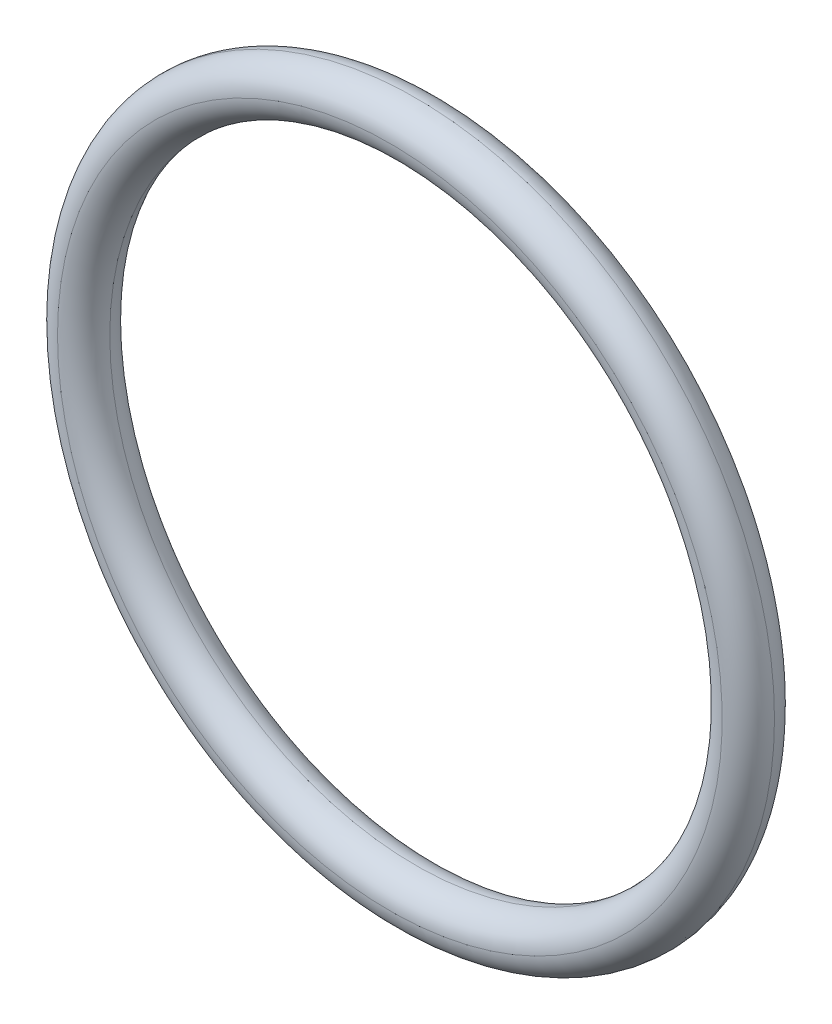
from build123d import *

# Parameters (mm, degrees)
SKETCH7_R           = 24
SKETCH7_R_2         = 20.5
BOSS_EXTRUDE6_DEPTH = 3.5
FILLET4_R           = 1.75


with BuildPart() as part:
    # Sketch7 → Boss-Extrude6 (new body)
    with BuildSketch(Plane(origin=(-0.280788986, 0.442554621, -13.906554041), x_dir=(-1, 0, 0), z_dir=(0, 0, -1))):
        with Locations((-13.807967582, -75.62783073)):
            Circle(SKETCH7_R)
        with Locations((-13.807967582, -75.62783073)):
            Circle(SKETCH7_R_2, mode=Mode.SUBTRACT)
    extrude(amount=BOSS_EXTRUDE6_DEPTH)

    # Fillet4
    fillet4_edges = [part.edges().sort_by_distance(p)[0] for p in [
        (37.527178596, -75.18527611, -13.906554041),
        (37.527178596, -75.18527611, -17.406554041),
        (34.027178596, -75.18527611, -13.906554041),
        (34.027178596, -75.18527611, -17.406554041),
    ]]
    fillet(fillet4_edges, radius=FILLET4_R - 0.0001)  # a hair under: the kernel refuses the full size


solid = part.part
